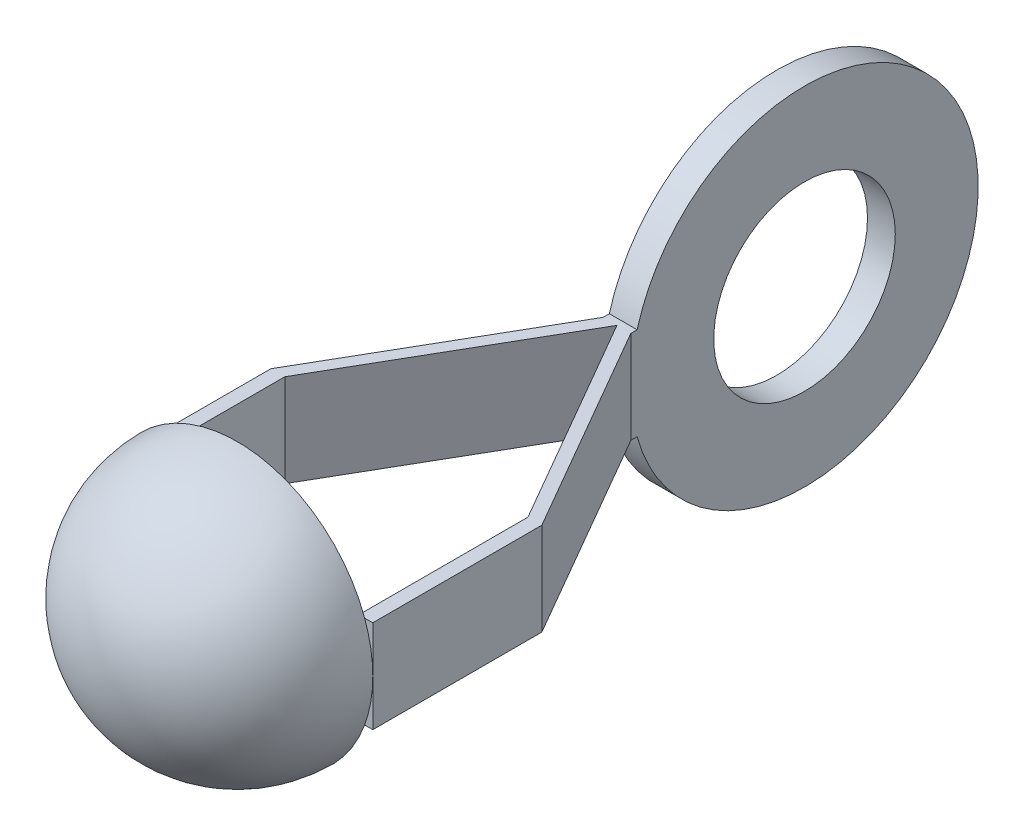
from build123d import *
from build123d.topology import SkipClean

# Parameters (mm, degrees)
BOSS_EXTRUDE1_DEPTH = 4.7625
SKETCH2_R           = 2.4892
SKETCH2_W           = 10.40972438
SKETCH2_H           = 3.4925
CUT_EXTRUDE1_DEPTH  = 12.922988592


# Read off the part's stored shape, not the designer's step: Revolve2
with BuildPart() as part:
    # Sketch1 → Boss-Extrude1 (new, symmetric)
    with BuildSketch(Plane(origin=(0, 0, 0), x_dir=(1, 0, 0), z_dir=(0, 1, 0))):
        Polygon((0, 0), (3.33375, -5.77422438), (3.33375, -10.40972438), (3.71475, -10.40972438), (3.71475, -5.77422438), (0.381, 0), (0.381, 9.525), (0, 9.525), align=None)
    boss_extrude1 = extrude(amount=BOSS_EXTRUDE1_DEPTH, both=True)

    # Sketch2 → Cut-Extrude1 (cut, symmetric)
    with BuildSketch(Plane(origin=(0.381, 0, 0), x_dir=(0, 0, -1), z_dir=(1, 0, 0))):
        with BuildLine():
            Line((0.172455746, -1.27), (0, -1.27))
            Line((0, -1.27), (0, -4.7625))
            Line((0, -4.7625), (4.7625, -4.7625))
            ThreePointArc((4.7625, -4.7625), (1.878663038, -3.790104303), (0.172455746, -1.27))
        make_face()
        with BuildLine():
            ThreePointArc((9.525, 0), (8.130096045, -3.367596045), (4.7625, -4.7625))
            Line((4.7625, -4.7625), (9.525, -4.7625))
            Line((9.525, -4.7625), (9.525, 0))
        make_face()
        with BuildLine():
            ThreePointArc((4.762500002, 4.7625), (8.130096046, 3.367596045), (9.525, 0))
            Line((9.525, 0), (9.525, 4.7625))
            Line((9.525, 4.7625), (4.762500002, 4.7625))
        make_face()
        with BuildLine():
            Line((0, 4.7625), (0, 1.27))
            Line((0, 1.27), (0.172455746, 1.27))
            ThreePointArc((0.172455746, 1.27), (1.878663039, 3.790104303), (4.762500002, 4.7625))
            Line((4.762500002, 4.7625), (0, 4.7625))
        make_face()
        with Locations((4.7625, 0)):
            Circle(SKETCH2_R)
        with Locations((-5.20486219, 3.01625)):
            Rectangle(SKETCH2_W, SKETCH2_H)
        with Locations((-5.20486219, -3.01625)):
            Rectangle(SKETCH2_W, SKETCH2_H)
    cut_extrude1 = extrude(amount=CUT_EXTRUDE1_DEPTH, both=True, mode=Mode.SUBTRACT)

    # Mirror1: Boss-Extrude1, Cut-Extrude1 across plane
    with SkipClean():  # the faces are left unmerged after this step: merging them gives an invalid solid
        add(boss_extrude1.mirror(Plane(origin=(0, 0, 0), x_dir=(0, 0, 1), z_dir=(1, 0, 0))))
        add(cut_extrude1.mirror(Plane(origin=(0, 0, 0), x_dir=(0, 0, 1), z_dir=(1, 0, 0))), mode=Mode.SUBTRACT)

    # Revolve2 outline → Revolve2 (revolve)
    with SkipClean():  # the faces are left unmerged after this step: merging them gives an invalid solid
        with BuildSketch(Plane.XZ):
            with BuildLine():
                ThreePointArc((0, 13.74347438), (2.357317233, 12.76704161), (3.33375, 10.409724376))
                Line((3.33375, 10.409724376), (3.71475, 10.409724377))
                ThreePointArc((3.71475, 10.409724377), (2.626724917, 13.036449294), (0, 14.12447438))
                Line((0, 14.12447438), (0, 13.74347438))
            make_face()
        revolve(axis=Axis((0, 0, 0), (0, 0, 1)))


solid = part.part
